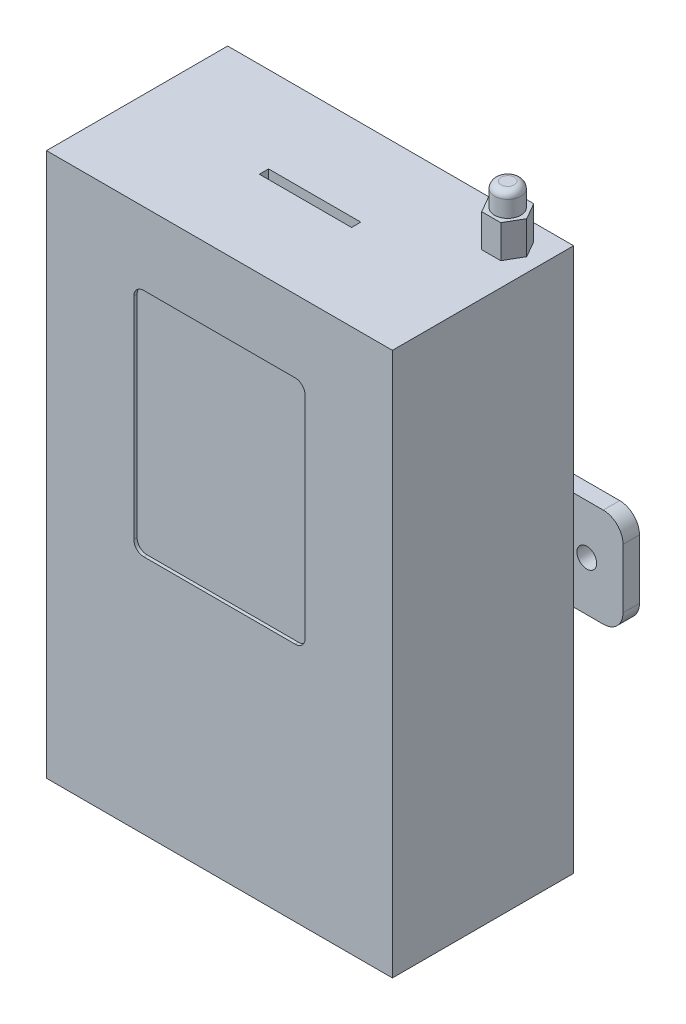
from build123d import *

# Parameters (mm, degrees)
SKETCH1_W           = 105
SKETCH1_H           = 55
BOSS_EXTRUDE1_DEPTH = 165
SKETCH2_W           = 28
SKETCH2_H           = 2.8
CUT_EXTRUDE1_DEPTH  = 50
BOSS_EXTRUDE2_START = 165
BOSS_EXTRUDE2_DEPTH = 10
SKETCH4_R           = 4
BOSS_EXTRUDE3_DEPTH = 7
FILLET1_R           = 2
CUT_EXTRUDE2_START  = 27.5
SKETCH5_W           = 52
SKETCH5_H           = 70
CUT_EXTRUDE2_DEPTH  = 1
SKETCH6_W           = 5
SKETCH6_H           = 10
CUT_EXTRUDE3_DEPTH  = 1
FILLET2_R           = 2.5
BOSS_EXTRUDE4_START = -27.5
SKETCH7_W           = 135
SKETCH7_H           = 30
SKETCH7_R           = 3
BOSS_EXTRUDE4_DEPTH = 5
FILLET3_R           = 6
FILLET4_R           = 3


with BuildPart() as part:
    # Sketch1 → Boss-Extrude1 (new body)
    with BuildSketch(Plane(origin=(0, 0, 0), x_dir=(1, 0, 0), z_dir=(0, 1, 0))):
        Rectangle(SKETCH1_W, SKETCH1_H)
    extrude(amount=BOSS_EXTRUDE1_DEPTH)

    # Sketch2 → Cut-Extrude1 (cut)
    with BuildSketch(Plane(origin=(0, 165, 0), x_dir=(1, 0, 0), z_dir=(0, 1, 0))):
        Rectangle(SKETCH2_W, SKETCH2_H)
    extrude(amount=-CUT_EXTRUDE1_DEPTH, mode=Mode.SUBTRACT)

    # Sketch3 → Boss-Extrude2 (add)
    with BuildSketch(Plane(origin=(0, 0, 0), x_dir=(1, 0, 0), z_dir=(0, 1, 0)).offset(BOSS_EXTRUDE2_START)):
        Polygon((48.273502692, 17.5), (45.386751346, 22.5), (39.613248654, 22.5), (36.726497308, 17.5), (39.613248654, 12.5), (45.386751346, 12.5), align=None)
    extrude(amount=BOSS_EXTRUDE2_DEPTH)

    # Sketch4 → Boss-Extrude3 (add)
    with BuildSketch(Plane(origin=(0, 175, 0), x_dir=(1, 0, 0), z_dir=(0, 1, 0))):
        with Locations(Location((42.5, 17.5, 0), (0, 0, 270))):
            Circle(SKETCH4_R)
    extrude(amount=BOSS_EXTRUDE3_DEPTH)

    # Fillet1
    fillet1_edges = [part.edges().sort_by_distance(p)[0] for p in [
        (42.5, 182, -21.5),
    ]]
    fillet(fillet1_edges, radius=FILLET1_R)

    # Sketch5 → Cut-Extrude2 (cut)
    with BuildSketch(Plane.XY.offset(CUT_EXTRUDE2_START)):
        with Locations((0, 108)):
            Rectangle(SKETCH5_W, SKETCH5_H)
    extrude(amount=-CUT_EXTRUDE2_DEPTH, mode=Mode.SUBTRACT)

    # Sketch6 → Cut-Extrude3 (cut)
    with BuildSketch(Plane(origin=(0, 0, 0), x_dir=(-1, 0, 0), z_dir=(0, -1, 0))):
        Rectangle(SKETCH6_W, SKETCH6_H)
    extrude(amount=-CUT_EXTRUDE3_DEPTH, mode=Mode.SUBTRACT)

    # Fillet2
    fillet2_edges = [part.edges().sort_by_distance(p)[0] for p in [
        (-2.5, 0.5, -5),
        (2.5, 0.5, -5),
        (2.5, 0.5, 5),
        (-2.5, 0.5, 5),
    ]]
    fillet(fillet2_edges, radius=FILLET2_R - 0.0001)  # a hair under: the kernel refuses the full size

    # Sketch7 → Boss-Extrude4 (add)
    with BuildSketch(Plane.XY.offset(BOSS_EXTRUDE4_START)):
        with Locations((0, 85)):
            Rectangle(SKETCH7_W, SKETCH7_H)
        with Locations((-56.5, 85)):
            Circle(SKETCH7_R, mode=Mode.SUBTRACT)
        with Locations((56.5, 85)):
            Circle(SKETCH7_R, mode=Mode.SUBTRACT)
    extrude(amount=-BOSS_EXTRUDE4_DEPTH)

    # Fillet3
    fillet3_edges = [part.edges().sort_by_distance(p)[0] for p in [
        (67.5, 70, -30),
        (-67.5, 70, -30),
        (-67.5, 100, -30),
        (67.5, 100, -30),
    ]]
    fillet(fillet3_edges, radius=FILLET3_R)

    # Fillet4
    fillet4_edges = [part.edges().sort_by_distance(p)[0] for p in [
        (26, 143, 27),
        (26, 73, 27),
        (-26, 73, 27),
        (-26, 143, 27),
    ]]
    fillet(fillet4_edges, radius=FILLET4_R)


solid = part.part
